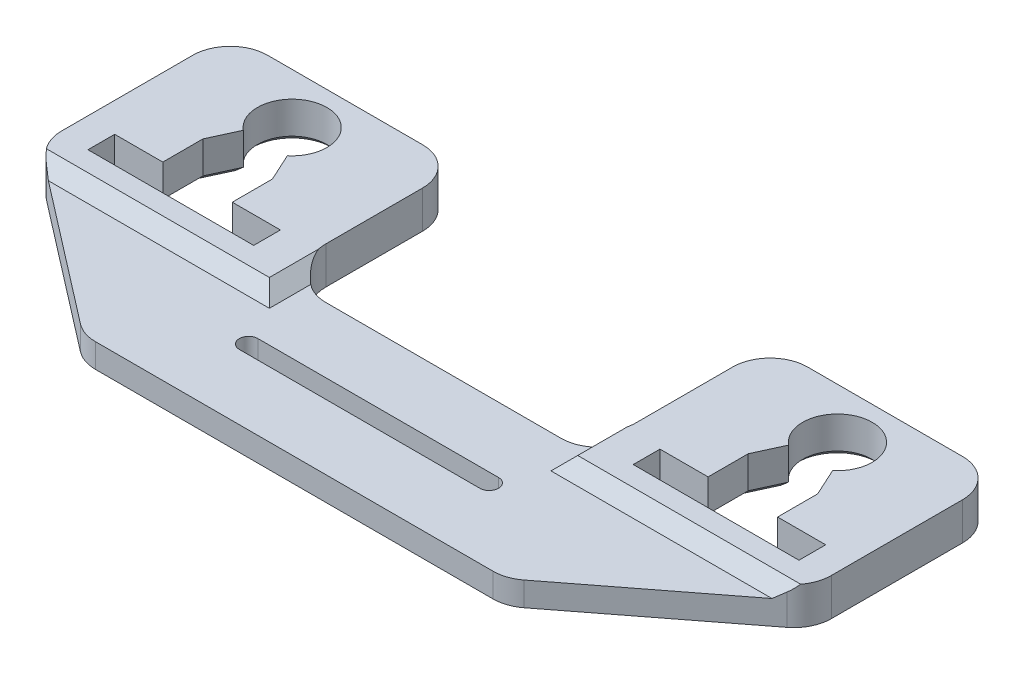
from build123d import *

# Parameters (mm, degrees)
SKETCH1_W           = 144
SKETCH1_H           = 35
BOSS_EXTRUDE1_DEPTH = 7
BOSS_EXTRUDE2_DEPTH = 7
SKETCH8_W           = 58
SKETCH8_H           = 32.108669786
CUT_EXTRUDE5_DEPTH  = 84.900238379
FILLET1_R           = 7
CUT_EXTRUDE3_DEPTH  = 84.900238379
CUT_EXTRUDE4_DEPTH  = 2.5
CHAMFER2_SIZE       = 2.5
CHAMFER3_SIZE       = 1


with BuildPart() as part:
    # Sketch1 → Boss-Extrude1 (new body)
    with BuildSketch(Plane(origin=(0, 0, 0), x_dir=(1, 0, 0), z_dir=(0, 1, 0))):
        Rectangle(SKETCH1_W, SKETCH1_H)
        with BuildLine():
            Line((-55.125, 3.06794739), (-57.5, -2.108669786))
            Line((-57.5, -2.108669786), (-57.5, -9.608669786))
            Line((-57.5, -9.608669786), (-66.5, -9.608669786))
            Line((-66.5, -9.608669786), (-66.5, -14.608669786))
            Line((-66.5, -14.608669786), (-35.5, -14.608669786))
            Line((-35.5, -14.608669786), (-35.5, -9.608669786))
            Line((-35.5, -9.608669786), (-44.5, -9.608669786))
            Line((-44.5, -9.608669786), (-44.5, -2.108669786))
            Line((-44.5, -2.108669786), (-46.875, 3.06794739))
            ThreePointArc((-46.875, 3.06794739), (-51, 14.591330214), (-55.125, 3.06794739))
        make_face(mode=Mode.SUBTRACT)
        with BuildLine():
            Line((46.875, 3.06794739), (44.5, -2.108669786))
            Line((44.5, -2.108669786), (44.5, -9.608669786))
            Line((44.5, -9.608669786), (35.5, -9.608669786))
            Line((35.5, -9.608669786), (35.5, -14.608669786))
            Line((35.5, -14.608669786), (66.5, -14.608669786))
            Line((66.5, -14.608669786), (66.5, -9.608669786))
            Line((66.5, -9.608669786), (57.5, -9.608669786))
            Line((57.5, -9.608669786), (57.5, -2.108669786))
            Line((57.5, -2.108669786), (55.125, 3.06794739))
            ThreePointArc((55.125, 3.06794739), (51, 14.591330214), (46.875, 3.06794739))
        make_face(mode=Mode.SUBTRACT)
    extrude(amount=BOSS_EXTRUDE1_DEPTH)

    # Sketch6 → Boss-Extrude2 (add)
    with BuildSketch(Plane(origin=(0, 7, 0), x_dir=(1, 0, 0), z_dir=(0, 1, 0))):
        Polygon((72, -17.5), (39.577085299, -42.5), (-39.577085299, -42.5), (-72, -17.5), align=None)
    extrude(amount=-BOSS_EXTRUDE2_DEPTH)

    # Sketch8 → Cut-Extrude5 (cut, through all)
    with BuildSketch(Plane(origin=(0, 7, 0), x_dir=(1, 0, 0), z_dir=(0, 1, 0))):
        with Locations((0, 1.445665107)):
            Rectangle(SKETCH8_W, SKETCH8_H)
    extrude(amount=-CUT_EXTRUDE5_DEPTH, mode=Mode.SUBTRACT)

    # Fillet1
    fillet1_edges = [part.edges().sort_by_distance(p)[0] for p in [
        (29, 3.5, -17.5),
        (29, 3.5, 14.608669786),
        (-72, 3.5, -17.5),
        (72, 3.5, -17.5),
        (39.577085299, 3.5, 42.5),
        (-39.577085299, 3.5, 42.5),
        (72, 3.5, 17.5),
        (-72, 3.5, 17.5),
        (-29, 3.5, 14.608669786),
        (-29, 3.5, -17.5),
    ]]
    fillet(fillet1_edges, radius=FILLET1_R)

    # Sketch4 → Cut-Extrude3 (cut, through all)
    with BuildSketch(Plane(origin=(0, 7, 0), x_dir=(1, 0, 0), z_dir=(0, 1, 0))):
        with BuildLine():
            Line((-22.5, -26.804334893), (22.5, -26.804334893))
            ThreePointArc((22.5, -26.804334893), (24.25, -28.554334893), (22.5, -30.304334893))
            Line((22.5, -30.304334893), (-22.5, -30.304334893))
            ThreePointArc((-22.5, -30.304334893), (-24.25, -28.554334893), (-22.5, -26.804334893))
        make_face()
    extrude(amount=-CUT_EXTRUDE3_DEPTH, mode=Mode.SUBTRACT)

    # Sketch5 → Cut-Extrude4 (cut)
    with BuildSketch(Plane(origin=(0, 7, 0), x_dir=(1, 0, 0), z_dir=(0, 1, 0))):
        Polygon((-28.837742903, 35.825509873), (-28.837742903, -18.333082707), (-81.160450989, -18.333082707), (-81.160450989, -59.181512703), (81.160450989, -59.181512703), (81.160450989, -18.333082707), (28.837742903, -18.333082707), (28.837742903, 35.825509873), align=None)
    extrude(amount=-CUT_EXTRUDE4_DEPTH, mode=Mode.SUBTRACT)

    # Chamfer2
    chamfer2_edges = [part.edges().sort_by_distance(p)[0] for p in [
        (28.837742903, 4.5, 13.720087831),
        (49.690387643, 4.5, 18.333082707),
        (-28.837742903, 4.5, 13.720087831),
        (-49.690387643, 4.5, 18.333082707),
    ]]
    chamfer(chamfer2_edges, length=CHAMFER2_SIZE - 0.0001)  # a hair under: the kernel refuses the full size

    # Chamfer3
    chamfer3_edges = [part.edges().sort_by_distance(p)[0] for p in [
        (-51, 0, -14.591330214),
        (-56.3125, 0, -0.479638802),
        (-57.5, 0, 5.858669786),
        (-62, 0, 9.608669786),
        (-66.5, 0, 12.108669786),
        (-51, 0, 14.608669786),
        (-35.5, 0, 12.108669786),
        (-40, 0, 9.608669786),
        (-44.5, 0, 5.858669786),
        (-45.6875, 0, -0.479638802),
        (51, 0, -14.591330214),
        (45.6875, 0, -0.479638802),
        (44.5, 0, 5.858669786),
        (40, 0, 9.608669786),
        (35.5, 0, 12.108669786),
        (51, 0, 14.608669786),
        (66.5, 0, 12.108669786),
        (62, 0, 9.608669786),
        (57.5, 0, 5.858669786),
        (56.3125, 0, -0.479638802),
    ]]
    chamfer(chamfer3_edges, length=CHAMFER3_SIZE)


solid = part.part
